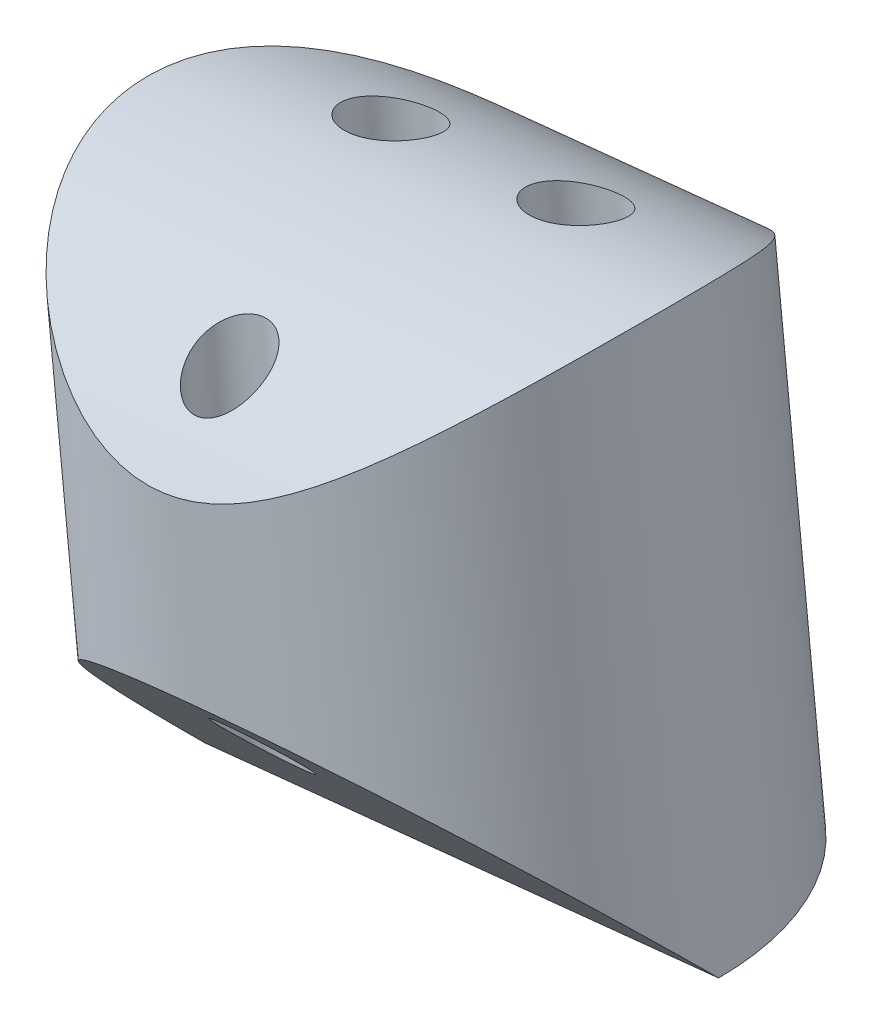
from build123d import *

# Parameters (mm, degrees)
SKETCH3_R               = 10
BOSS_EXTRUDE1_DEPTH     = 21.614736842
CUT_EXTRUDE1_DEPTH      = 221.218385944
CUT_EXTRUDE1_DEPTH_BACK = 221.218385944
CUT_EXTRUDE2_DEPTH      = 220.980892188
CUT_EXTRUDE2_DEPTH_BACK = 220.980892188
CUT_EXTRUDE3_DEPTH      = 28.49370821
CUT_EXTRUDE3_DEPTH_BACK = 28.49370821
SKETCH8_R               = 1.6
SKETCH8_R_2             = 1.4


with BuildPart() as part:
    # Sketch3 → Boss-Extrude1 (new body)
    with BuildSketch(Plane(origin=(-12.082314344, 217.636022384, 0), x_dir=(-0.9946657577296572, -0.10315052302381673, 0), z_dir=(0.10315052302381673, -0.9946657577296572, 0))):
        Circle(SKETCH3_R)
    extrude(amount=BOSS_EXTRUDE1_DEPTH)

    # Sketch4 → Cut-Extrude1 (cut, two sides: drawn at the far end of the back side and taken through both)
    with BuildSketch(Plane(origin=(10.375761543, 1.076004901, 0), x_dir=(0.10315052302381672, -0.9946657577296572, 0), z_dir=(-0.9946657577296572, -0.10315052302381673, 0)).offset(-CUT_EXTRUDE1_DEPTH_BACK)):
        with BuildLine():
            Line((-217.721396158, 10), (-212.721396158, 10))
            ThreePointArc((-212.721396158, 10), (-217.483420892, 0), (-212.721396158, -10))
            Line((-212.721396158, -10), (-217.721396158, -10))
            Line((-217.721396158, -10), (-217.721396158, 10))
        make_face()
    extrude(amount=CUT_EXTRUDE1_DEPTH + CUT_EXTRUDE1_DEPTH_BACK, mode=Mode.SUBTRACT)

    # Sketch5 → Cut-Extrude2 (cut, two sides: drawn at the far end of the back side and taken through both)
    with BuildSketch(Plane(origin=(10.375761543, 1.076004901, 0), x_dir=(0.10315052302381672, -0.9946657577296572, 0), z_dir=(-0.9946657577296572, -0.10315052302381673, 0)).offset(-CUT_EXTRUDE2_DEPTH_BACK)):
        Polygon((-196.106659316, 0), (-206.106659316, 10), (-196.106659316, 10), align=None)
    extrude(amount=CUT_EXTRUDE2_DEPTH + CUT_EXTRUDE2_DEPTH_BACK, mode=Mode.SUBTRACT)

    # Sketch8 → Cut-Extrude3 (cut, two sides: drawn at the far end of the back side and taken through both)
    with BuildSketch(Plane(origin=(-12.082314344, 217.636022384, 0), x_dir=(-0.9946657577296572, -0.10315052302381673, 0), z_dir=(0.10315052302381673, -0.9946657577296572, 0)).offset(-CUT_EXTRUDE3_DEPTH_BACK)):
        with Locations((-3.6, 3)):
            Circle(SKETCH8_R)
        with Locations((3.6, 3)):
            Circle(SKETCH8_R)
        with Locations((0, -7)):
            Circle(SKETCH8_R_2)
    extrude(amount=CUT_EXTRUDE3_DEPTH + CUT_EXTRUDE3_DEPTH_BACK, mode=Mode.SUBTRACT)


solid = part.part
